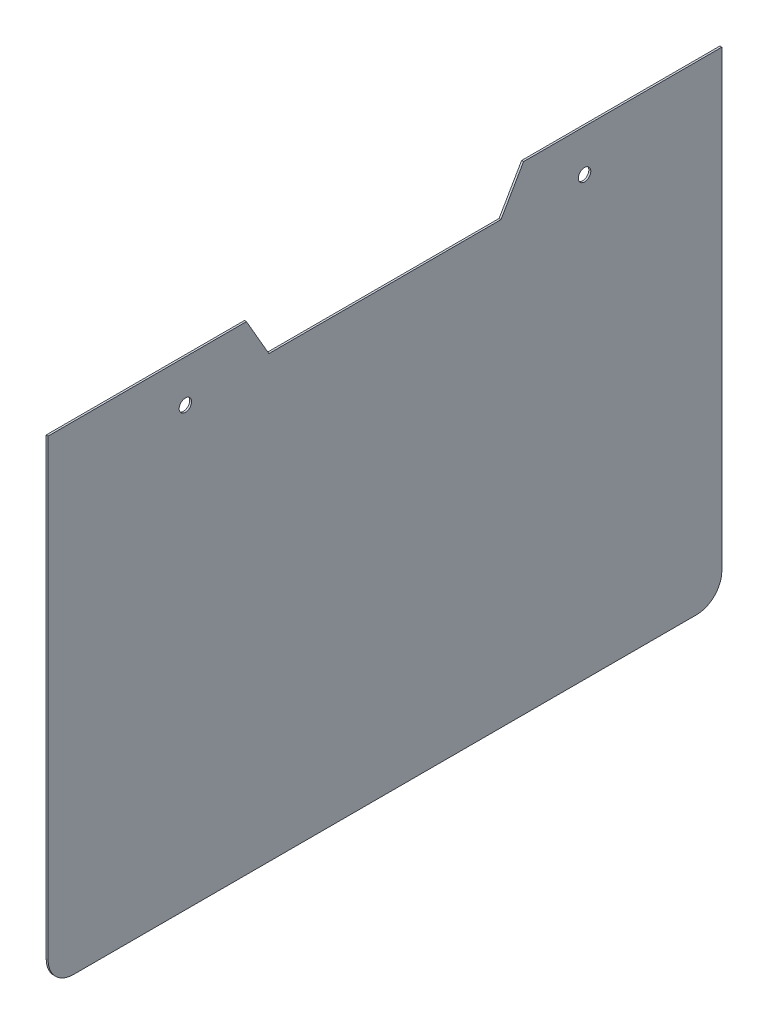
from build123d import *

# Parameters (mm, degrees)
BOSS_EXTRUDE1_DEPTH = 0.5
CUT_EXTRUDE2_REACH  = 381.906
SKETCH2_R           = 1.6
CUT_EXTRUDE3_DEPTH  = 0.25


with BuildPart() as part:
    # Sketch1 → Boss-Extrude1 (new body)
    with BuildSketch(Plane.ZY.offset(-169.533617861)):
        with BuildLine():
            Line((-82.985361374, 164.213254624), (-82.985361374, 280.713254624))
            Line((-82.985361374, 280.713254624), (-133.908011105, 280.713254624))
            Line((-133.908011105, 280.713254624), (-139.681513797, 270.713254624))
            Line((-139.681513797, 270.713254624), (-199.289208951, 270.713254624))
            Line((-199.289208951, 270.713254624), (-205.062711643, 280.713254624))
            Line((-205.062711643, 280.713254624), (-255.985361374, 280.713254624))
            Line((-255.985361374, 280.713254624), (-255.985361374, 164.213254624))
            ThreePointArc((-255.985361374, 164.213254624), (-254.081555452, 159.617060547), (-249.485361374, 157.713254624))
            Line((-249.485361374, 157.713254624), (-89.485361374, 157.713254624))
            ThreePointArc((-89.485361374, 157.713254624), (-84.889167296, 159.617060547), (-82.985361374, 164.213254624))
        make_face()
    extrude(amount=BOSS_EXTRUDE1_DEPTH)

    # Sketch2 → Cut-Extrude2 (cut, up to next)
    with BuildSketch(Plane.ZY.offset(-169.033617861), mode=Mode.PRIVATE) as cut_extrude2_sk1:
        with Locations((-118.235361374, 269.963254624)):
            Circle(SKETCH2_R)
    cut_extrude2_tool1 = extrude(cut_extrude2_sk1.sketch, amount=-CUT_EXTRUDE2_REACH, mode=Mode.PRIVATE) & part.part
    # Sketch2 → Cut-Extrude2 (cut, up to next)
    with BuildSketch(Plane.ZY.offset(-169.033617861), mode=Mode.PRIVATE) as cut_extrude2_sk2:
        with Locations((-220.735361374, 269.963254624)):
            Circle(SKETCH2_R)
    cut_extrude2_tool2 = extrude(cut_extrude2_sk2.sketch, amount=-CUT_EXTRUDE2_REACH, mode=Mode.PRIVATE) & part.part
    add(cut_extrude2_tool1.solids().sort_by_distance((169.033618, 269.963255, -118.235361))[0], mode=Mode.SUBTRACT)
    add(cut_extrude2_tool2.solids().sort_by_distance((169.033618, 269.963255, -220.735361))[0], mode=Mode.SUBTRACT)

    # Sketch4 → Cut-Extrude3 (cut)
    # profile 1 of 11: a face of its own
    with BuildSketch(Plane(origin=(169.033617861, 0, -163.257078024), x_dir=(0, 0, 1), z_dir=(-1, 0, 0))):
        with BuildLine():
            Line((1.31445665, 240.491320834), (-13.92554335, 240.489200834))
            Line((-13.92554335, 240.489200834), (-13.92554335, 240.452160834))
            add(Edge.make_bspline(
                [(-13.92554335, 240.452160834), (-13.92554335, 232.182360834), (-13.92554335, 226.720280834), (-6.32246335, 222.719800834)],
                knots=[0.125, 0.125, 0.125, 0.125, 0.25, 0.25, 0.25, 0.25], degree=3))
            Line((-6.32246335, 222.719800834), (-6.30554335, 222.710280834))
            Line((-6.30554335, 222.710280834), (-6.28862335, 222.719800834))
            add(Edge.make_bspline(
                [(-6.28862335, 222.719800834), (1.31445665, 226.703360834), (1.31445665, 232.173880834), (1.31445665, 240.454280834)],
                knots=[0.5, 0.5, 0.5, 0.5, 0.625, 0.625, 0.625, 0.625], degree=3))
            Line((1.31445665, 240.454280834), (1.31445665, 240.491320834))
        make_face()
        with BuildLine():
            Line((0.74505665, 239.879600834), (0.74505665, 239.854200834))
            add(Edge.make_bspline(
                [(0.74505665, 239.263640834), (0.74505665, 239.460520834), (0.74505665, 239.657360834), (0.74505665, 239.854200834)],
                knots=[0.833333333, 0.833333333, 0.833333333, 0.833333333, 1, 1, 1, 1], degree=3))
            add(Edge.make_bspline(
                [(-6.28862335, 223.399240834), (0.75881665, 227.060000834), (0.75245665, 232.988800834), (0.74505665, 239.263640834)],
                knots=[0.75, 0.75, 0.75, 0.75, 0.833333333, 0.833333333, 0.833333333, 0.833333333], degree=3))
            Line((-6.28862335, 223.399240834), (-6.30026335, 223.392880834))
            Line((-6.30026335, 223.392880834), (-6.31190335, 223.399240834))
            add(Edge.make_bspline(
                [(-10.40446335, 226.537200834), (-9.35354335, 225.302120834), (-8.01474335, 224.275560834), (-6.31190335, 223.399240834)],
                knots=[0.5, 0.5, 0.5, 0.5, 0.583333333, 0.583333333, 0.583333333, 0.583333333], degree=3))
            add(Edge.make_bspline(
                [(-12.50418335, 230.349320834), (-12.03006335, 228.886720834), (-11.34318335, 227.640000834), (-10.40446335, 226.537200834)],
                knots=[0.416666667, 0.416666667, 0.416666667, 0.416666667, 0.5, 0.5, 0.5, 0.5], degree=3))
            add(Edge.make_bspline(
                [(-13.37626335, 239.173680834), (-13.38154335, 236.033640834), (-13.38578335, 233.068160834), (-12.50418335, 230.349320834)],
                knots=[0.333333333, 0.333333333, 0.333333333, 0.333333333, 0.416666667, 0.416666667, 0.416666667, 0.416666667], degree=3))
            add(Edge.make_bspline(
                [(-13.37522335, 239.852080834), (-13.37522335, 239.625600834), (-13.37522335, 239.399120834), (-13.37626335, 239.173680834)],
                knots=[0.25, 0.25, 0.25, 0.25, 0.333333333, 0.333333333, 0.333333333, 0.333333333], degree=3))
            Line((-13.37522335, 239.852080834), (-13.37522335, 239.877480834))
            Line((-13.37522335, 239.877480834), (0.74505665, 239.879600834))
        make_face(mode=Mode.SUBTRACT)
    # profile 2 of 11: a face of its own
    with BuildSketch(Plane(origin=(169.033617861, 0, -163.257078024), x_dir=(0, 0, 1), z_dir=(-1, 0, 0))):
        Polygon((-6.23674335, 236.958600834), (-4.07882335, 236.287640834), (-4.07882335, 237.371360834), (-8.35342335, 237.371360834), (-8.35342335, 236.298200834), align=None)
    # profile 3 of 11: a face of its own
    with BuildSketch(Plane(origin=(169.033617861, 0, -163.257078024), x_dir=(0, 0, 1), z_dir=(-1, 0, 0))):
        with BuildLine():
            add(Edge.make_bspline(
                [(-6.23778335, 239.069960834), (-6.48650335, 238.842440834), (-6.76378335, 238.577880834), (-6.76378335, 238.201080834)],
                knots=[0.5, 0.5, 0.5, 0.5, 1, 1, 1, 1], degree=3))
            Line((-6.76378335, 238.201080834), (-5.69698335, 238.201080834))
            add(Edge.make_bspline(
                [(-5.69698335, 238.201080834), (-5.69170335, 238.567280834), (-5.98590335, 238.846680834), (-6.23778335, 239.069960834)],
                knots=[0.25, 0.25, 0.25, 0.25, 0.5, 0.5, 0.5, 0.5], degree=3))
        make_face()
    # profile 4 of 11: a face of its own
    with BuildSketch(Plane(origin=(169.033617861, 0, -163.257078024), x_dir=(0, 0, 1), z_dir=(-1, 0, 0))):
        with BuildLine():
            add(Edge.make_bspline(
                [(-4.59422335, 237.409480834), (-4.79318335, 237.771400834), (-5.20806335, 238.050800834), (-5.71818335, 238.164040834)],
                knots=[0.6, 0.6, 0.6, 0.6, 1, 1, 1, 1], degree=3))
            Line((-5.71818335, 238.164040834), (-6.72886335, 238.164040834))
            add(Edge.make_bspline(
                [(-6.72886335, 238.164040834), (-7.23898335, 238.049720834), (-7.65386335, 237.771400834), (-7.85282335, 237.409440834)],
                knots=[0.2, 0.2, 0.2, 0.2, 0.4, 0.4, 0.4, 0.4], degree=3))
            Line((-7.85282335, 237.409440834), (-4.59422335, 237.409480834))
        make_face()
    # profile 5 of 11: a face of its own
    with BuildSketch(Plane(origin=(169.033617861, 0, -163.257078024), x_dir=(0, 0, 1), z_dir=(-1, 0, 0))):
        with BuildLine():
            add(Edge.make_bspline(
                [(-8.80954335, 229.737600834), (-8.76510335, 229.757720834), (-8.76722335, 229.693160834), (-8.76722335, 229.633880834)],
                knots=[0, 0, 0, 0, 0.058823529, 0.058823529, 0.058823529, 0.058823529], degree=3))
            Line((-8.76722335, 229.633880834), (-8.76722335, 228.388240834))
            add(Edge.make_bspline(
                [(-8.76722335, 228.388240834), (-8.76722335, 228.293000834), (-8.83706335, 228.261240834), (-8.92702335, 228.255960834)],
                knots=[0.117647059, 0.117647059, 0.117647059, 0.117647059, 0.176470588, 0.176470588, 0.176470588, 0.176470588], degree=3))
            Line((-8.92702335, 228.255960834), (-9.13022335, 228.247480834))
            Line((-9.13022335, 228.247480834), (-9.13022335, 228.142720834))
            add(Edge.make_bspline(
                [(-9.13022335, 228.142720834), (-8.80106335, 228.145880834), (-8.67938335, 228.151200834), (-8.43486335, 228.151200834), (-8.31634335, 228.145920834), (-8.06022335, 228.142720834)],
                knots=[0.294117647, 0.294117647, 0.294117647, 0.294117647, 0.352941176, 0.352941176, 0.413304997, 0.413304997, 0.413304997, 0.413304997], degree=3))
            Line((-8.06022335, 228.142720834), (-8.06022335, 228.247480834))
            Line((-8.06022335, 228.247480834), (-8.23590335, 228.255960834))
            add(Edge.make_bspline(
                [(-8.23590335, 228.255960834), (-8.32482335, 228.261240834), (-8.39570335, 228.291960834), (-8.39570335, 228.388240834)],
                knots=[0.529411765, 0.529411765, 0.529411765, 0.529411765, 0.588235294, 0.588235294, 0.588235294, 0.588235294], degree=3))
            Line((-8.39570335, 228.388240834), (-8.39570335, 229.294160834))
            add(Edge.make_bspline(
                [(-8.39570335, 229.294160834), (-8.39570335, 229.630720834), (-8.37666335, 229.872000834), (-8.36714335, 230.007480834)],
                knots=[0.647058824, 0.647058824, 0.647058824, 0.647058824, 0.705882353, 0.705882353, 0.705882353, 0.705882353], degree=3))
            Line((-8.36714335, 230.007480834), (-8.40206335, 230.037120834))
            add(Edge.make_bspline(
                [(-8.40206335, 230.037120834), (-8.64442335, 229.940800834), (-9.03706335, 229.801120834), (-9.24238335, 229.752440834)],
                knots=[0.764705882, 0.764705882, 0.764705882, 0.764705882, 0.823529412, 0.823529412, 0.823529412, 0.823529412], degree=3))
            add(Edge.make_bspline(
                [(-9.24238335, 229.752440834), (-9.24662335, 229.693160834), (-9.23390335, 229.630720834), (-9.20322335, 229.555600834)],
                knots=[0.823529412, 0.823529412, 0.823529412, 0.823529412, 0.882352941, 0.882352941, 0.882352941, 0.882352941], degree=3))
            Line((-9.20322335, 229.555600834), (-8.80954335, 229.737600834))
        make_face()
    # profile 6 of 11: a face of its own
    with BuildSketch(Plane(origin=(169.033617861, 0, -163.257078024), x_dir=(0, 0, 1), z_dir=(-1, 0, 0))):
        with BuildLine():
            add(Edge.make_bspline(
                [(-5.63350335, 229.737600834), (-5.58906335, 229.757720834), (-5.59118335, 229.693160834), (-5.59118335, 229.633880834)],
                knots=[0, 0, 0, 0, 0.058823529, 0.058823529, 0.058823529, 0.058823529], degree=3))
            Line((-5.59118335, 229.633880834), (-5.59118335, 228.388240834))
            add(Edge.make_bspline(
                [(-5.59118335, 228.388240834), (-5.59118335, 228.293000834), (-5.66102335, 228.261240834), (-5.75098335, 228.255960834)],
                knots=[0.117647059, 0.117647059, 0.117647059, 0.117647059, 0.176470588, 0.176470588, 0.176470588, 0.176470588], degree=3))
            Line((-5.75098335, 228.255960834), (-5.95418335, 228.247480834))
            Line((-5.95418335, 228.247480834), (-5.95418335, 228.142720834))
            add(Edge.make_bspline(
                [(-5.95418335, 228.142720834), (-5.62502335, 228.145880834), (-5.50334335, 228.151200834), (-5.25882335, 228.151200834), (-5.14030335, 228.145920834), (-4.88314335, 228.142720834)],
                knots=[0.294117647, 0.294117647, 0.294117647, 0.294117647, 0.352941176, 0.352941176, 0.413304997, 0.413304997, 0.413304997, 0.413304997], degree=3))
            Line((-4.88314335, 228.142720834), (-4.88314335, 228.247480834))
            Line((-4.88314335, 228.247480834), (-5.05882335, 228.255960834))
            add(Edge.make_bspline(
                [(-5.05882335, 228.255960834), (-5.14878335, 228.261240834), (-5.21862335, 228.291960834), (-5.21862335, 228.388240834)],
                knots=[0.529411765, 0.529411765, 0.529411765, 0.529411765, 0.588235294, 0.588235294, 0.588235294, 0.588235294], degree=3))
            Line((-5.21862335, 228.388240834), (-5.21862335, 229.294160834))
            add(Edge.make_bspline(
                [(-5.21862335, 229.294160834), (-5.21862335, 229.630720834), (-5.19958335, 229.872000834), (-5.19110335, 230.007480834)],
                knots=[0.647058824, 0.647058824, 0.647058824, 0.647058824, 0.705882353, 0.705882353, 0.705882353, 0.705882353], degree=3))
            Line((-5.19110335, 230.007480834), (-5.22498335, 230.037120834))
            add(Edge.make_bspline(
                [(-5.22498335, 230.037120834), (-5.46630335, 229.940800834), (-5.85998335, 229.801120834), (-6.06634335, 229.752440834)],
                knots=[0.764705882, 0.764705882, 0.764705882, 0.764705882, 0.823529412, 0.823529412, 0.823529412, 0.823529412], degree=3))
            add(Edge.make_bspline(
                [(-6.06634335, 229.752440834), (-6.06846335, 229.693160834), (-6.05786335, 229.630720834), (-6.02614335, 229.555600834)],
                knots=[0.823529412, 0.823529412, 0.823529412, 0.823529412, 0.882352941, 0.882352941, 0.882352941, 0.882352941], degree=3))
            Line((-6.02614335, 229.555600834), (-5.63350335, 229.737600834))
        make_face()
    # profile 7 of 11: a face of its own
    with BuildSketch(Plane(origin=(169.033617861, 0, -163.257078024), x_dir=(0, 0, 1), z_dir=(-1, 0, 0))):
        with BuildLine():
            add(Edge.make_bspline(
                [(-4.14970335, 229.737600834), (-4.10526335, 229.757720834), (-4.10738335, 229.693160834), (-4.10738335, 229.633880834)],
                knots=[0, 0, 0, 0, 0.058823529, 0.058823529, 0.058823529, 0.058823529], degree=3))
            Line((-4.10738335, 229.633880834), (-4.10738335, 228.388240834))
            add(Edge.make_bspline(
                [(-4.10738335, 228.388240834), (-4.10738335, 228.293000834), (-4.17722335, 228.261240834), (-4.26718335, 228.255960834)],
                knots=[0.117647059, 0.117647059, 0.117647059, 0.117647059, 0.176470588, 0.176470588, 0.176470588, 0.176470588], degree=3))
            Line((-4.26718335, 228.255960834), (-4.46934335, 228.247480834))
            Line((-4.46934335, 228.247480834), (-4.46934335, 228.142720834))
            add(Edge.make_bspline(
                [(-4.46934335, 228.142720834), (-4.14018335, 228.145880834), (-4.01850335, 228.151200834), (-3.77506335, 228.151200834), (-3.65654335, 228.145920834), (-3.39938335, 228.142720834)],
                knots=[0.294117647, 0.294117647, 0.294117647, 0.294117647, 0.352941176, 0.352941176, 0.413850089, 0.413850089, 0.413850089, 0.413850089], degree=3))
            Line((-3.39938335, 228.142720834), (-3.39938335, 228.247480834))
            Line((-3.39938335, 228.247480834), (-3.57506335, 228.255960834))
            add(Edge.make_bspline(
                [(-3.57506335, 228.255960834), (-3.66502335, 228.261240834), (-3.73594335, 228.291960834), (-3.73594335, 228.388240834)],
                knots=[0.529411765, 0.529411765, 0.529411765, 0.529411765, 0.588235294, 0.588235294, 0.588235294, 0.588235294], degree=3))
            Line((-3.73594335, 228.388240834), (-3.73594335, 229.294160834))
            add(Edge.make_bspline(
                [(-3.73594335, 229.294160834), (-3.73594335, 229.630720834), (-3.71690335, 229.872000834), (-3.70738335, 230.007480834)],
                knots=[0.647058824, 0.647058824, 0.647058824, 0.647058824, 0.705882353, 0.705882353, 0.705882353, 0.705882353], degree=3))
            Line((-3.70738335, 230.007480834), (-3.74126335, 230.037120834))
            add(Edge.make_bspline(
                [(-3.74126335, 230.037120834), (-3.98258335, 229.940800834), (-4.37626335, 229.801120834), (-4.58262335, 229.752440834)],
                knots=[0.764705882, 0.764705882, 0.764705882, 0.764705882, 0.823529412, 0.823529412, 0.823529412, 0.823529412], degree=3))
            add(Edge.make_bspline(
                [(-4.58262335, 229.752440834), (-4.58578335, 229.693160834), (-4.57414335, 229.630720834), (-4.54242335, 229.555600834)],
                knots=[0.823529412, 0.823529412, 0.823529412, 0.823529412, 0.882352941, 0.882352941, 0.882352941, 0.882352941], degree=3))
            Line((-4.54242335, 229.555600834), (-4.14970335, 229.737600834))
        make_face()
    # profile 8 of 11: a face of its own
    with BuildSketch(Plane(origin=(169.033617861, 0, -163.257078024), x_dir=(0, 0, 1), z_dir=(-1, 0, 0))):
        with BuildLine():
            add(Edge.make_bspline(
                [(-5.45462335, 232.808840834), (-5.53506335, 232.810960834), (-5.61654335, 232.813080834), (-5.69698335, 232.815200834)],
                knots=[0.09375, 0.09375, 0.09375, 0.09375, 0.125, 0.125, 0.125, 0.125], degree=3))
            Line((-5.69698335, 232.815200834), (-5.71922335, 232.815200834))
            Line((-5.71922335, 232.815200834), (-5.71922335, 232.596120834))
            Line((-5.71922335, 232.596120834), (-5.47158335, 232.586600834))
            add(Edge.make_bspline(
                [(-5.47158335, 232.586600834), (-5.32554335, 232.581320834), (-5.24722335, 232.556960834), (-5.24722335, 232.447960834)],
                knots=[0.21875, 0.21875, 0.21875, 0.21875, 0.25, 0.25, 0.25, 0.25], degree=3))
            Line((-5.24722335, 232.447960834), (-5.24722335, 231.895520834))
            add(Edge.make_bspline(
                [(-5.24722335, 231.895520834), (-5.43242335, 231.826720834), (-5.59966335, 231.793920834), (-6.61034335, 231.793920834), (-6.90774335, 232.533680834), (-6.90774335, 233.887320834), (-6.49710335, 234.333920834), (-5.44938335, 234.333920834), (-5.10434335, 234.222800834), (-4.95194335, 234.049240834)],
                knots=[0.28125, 0.28125, 0.28125, 0.28125, 0.3125, 0.3125, 0.464365434, 0.464365434, 0.636765136, 0.636765136, 0.737446312, 0.737446312, 0.737446312, 0.737446312], degree=3))
            Line((-4.95194335, 234.049240834), (-4.93078335, 233.687280834))
            Line((-4.93078335, 233.687280834), (-4.92970335, 233.668240834))
            Line((-4.92970335, 233.668240834), (-4.72334335, 233.668240834))
            Line((-4.72334335, 233.668240834), (-4.71382335, 233.753960834))
            add(Edge.make_bspline(
                [(-4.71382335, 233.753960834), (-4.69158335, 233.944480834), (-4.65986335, 234.205880834), (-4.62282335, 234.342400834)],
                knots=[0.53125, 0.53125, 0.53125, 0.53125, 0.5625, 0.5625, 0.5625, 0.5625], degree=3))
            Line((-4.62282335, 234.342400834), (-4.61966335, 234.350880834))
            Line((-4.61966335, 234.350880834), (-4.65354335, 234.411200834))
            Line((-4.65354335, 234.411200834), (-4.65990335, 234.414360834))
            add(Edge.make_bspline(
                [(-4.65990335, 234.414360834), (-5.09698335, 234.594280834), (-5.50762335, 234.618600834), (-6.71942335, 234.618600834), (-7.59570335, 234.152920834), (-7.59570335, 232.125160834), (-6.93426335, 231.511360834), (-5.46738335, 231.511360834), (-5.05358335, 231.596040834), (-4.60482335, 231.769600834)],
                knots=[0.65625, 0.65625, 0.65625, 0.65625, 0.6875, 0.6875, 0.766346377, 0.766346377, 0.841184953, 0.841184953, 0.869452555, 0.869452555, 0.869452555, 0.869452555], degree=3))
            Line((-4.60482335, 231.769600834), (-4.59106335, 231.774880834))
            Line((-4.59106335, 231.774880834), (-4.59106335, 232.492440834))
            add(Edge.make_bspline(
                [(-4.59106335, 232.492440834), (-4.59106335, 232.580280834), (-4.53922335, 232.595080834), (-4.38786335, 232.625800834)],
                knots=[0.84375, 0.84375, 0.84375, 0.84375, 0.875, 0.875, 0.875, 0.875], degree=3))
            Line((-4.38786335, 232.625800834), (-4.37094335, 232.628960834))
            Line((-4.37094335, 232.628960834), (-4.37094335, 232.815240834))
            Line((-4.37094335, 232.815240834), (-4.39206335, 232.814160834))
            add(Edge.make_bspline(
                [(-4.39206335, 232.814160834), (-4.45238335, 232.813120834), (-4.51590335, 232.811000834), (-4.58150335, 232.809920834)],
                knots=[0, 0, 0, 0, 0.03125, 0.03125, 0.03125, 0.03125], degree=3))
            add(Edge.make_bspline(
                [(-4.58150335, 232.809920834), (-4.74450335, 232.805680834), (-4.91486335, 232.801440834), (-5.19426335, 232.801440834), (-5.32654335, 232.804600834), (-5.45462335, 232.808840834)],
                knots=[0.03125, 0.03125, 0.03125, 0.03125, 0.0625, 0.0625, 0.08934988, 0.08934988, 0.08934988, 0.08934988], degree=3))
        make_face()
    # profile 9 of 11: a face of its own
    with BuildSketch(Plane(origin=(169.033617861, 0, -163.257078024), x_dir=(0, 0, 1), z_dir=(-1, 0, 0))):
        with BuildLine():
            add(Edge.make_bspline(
                [(-8.11106335, 234.282080834), (-8.09518335, 234.313840834), (-8.06342335, 234.333920834), (-7.95126335, 234.343480834)],
                knots=[0, 0, 0, 0, 0.015151515, 0.015151515, 0.015151515, 0.015151515], degree=3))
            Line((-7.95126335, 234.343480834), (-7.77242335, 234.358280834))
            Line((-7.77242335, 234.358280834), (-7.77242335, 234.559360834))
            Line((-7.77242335, 234.559360834), (-7.79466335, 234.559360834))
            add(Edge.make_bspline(
                [(-7.79466335, 234.559360834), (-7.88462335, 234.557240834), (-7.96398335, 234.555120834), (-8.03598335, 234.551960834)],
                knots=[0.060606061, 0.060606061, 0.060606061, 0.060606061, 0.075757576, 0.075757576, 0.075757576, 0.075757576], degree=3))
            add(Edge.make_bspline(
                [(-8.03598335, 234.551960834), (-8.13442335, 234.548800834), (-8.22014335, 234.545600834), (-8.29422335, 234.545600834)],
                knots=[0.075757576, 0.075757576, 0.075757576, 0.075757576, 0.090909091, 0.090909091, 0.090909091, 0.090909091], degree=3))
            add(Edge.make_bspline(
                [(-8.29422335, 234.545600834), (-8.36726335, 234.545600834), (-8.45402335, 234.548760834), (-8.55350335, 234.551960834)],
                knots=[0.090909091, 0.090909091, 0.090909091, 0.090909091, 0.106060606, 0.106060606, 0.106060606, 0.106060606], degree=3))
            add(Edge.make_bspline(
                [(-8.55350335, 234.551960834), (-8.62442335, 234.554080834), (-8.70166335, 234.557240834), (-8.78846335, 234.558320834)],
                knots=[0.106060606, 0.106060606, 0.106060606, 0.106060606, 0.121212121, 0.121212121, 0.121212121, 0.121212121], degree=3))
            Line((-8.78846335, 234.558320834), (-8.80326335, 234.558320834))
            Line((-8.80326335, 234.558320834), (-8.80854335, 234.544560834))
            add(Edge.make_bspline(
                [(-8.80854335, 234.544560834), (-8.82758335, 234.501160834), (-8.84666335, 234.455640834), (-8.86570335, 234.408040834)],
                knots=[0.151515152, 0.151515152, 0.151515152, 0.151515152, 0.166666667, 0.166666667, 0.166666667, 0.166666667], degree=3))
            add(Edge.make_bspline(
                [(-8.86570335, 234.408040834), (-8.91438335, 234.291640834), (-8.96414335, 234.170960834), (-9.01914335, 234.058800834)],
                knots=[0.166666667, 0.166666667, 0.166666667, 0.166666667, 0.181818182, 0.181818182, 0.181818182, 0.181818182], degree=3))
            Line((-9.01914335, 234.058800834), (-9.78854335, 232.471280834))
            Line((-9.78854335, 232.471280834), (-10.44894335, 233.851360834))
            add(Edge.make_bspline(
                [(-10.44894335, 233.851360834), (-10.47962335, 233.916960834), (-10.51666335, 233.996360834), (-10.55690335, 234.079960834)],
                knots=[0.212121212, 0.212121212, 0.212121212, 0.212121212, 0.227272727, 0.227272727, 0.227272727, 0.227272727], degree=3))
            add(Edge.make_bspline(
                [(-10.55690335, 234.079960834), (-10.63414335, 234.242960834), (-10.72094335, 234.428160834), (-10.77282335, 234.544560834)],
                knots=[0.227272727, 0.227272727, 0.227272727, 0.227272727, 0.242424242, 0.242424242, 0.242424242, 0.242424242], degree=3))
            Line((-10.77282335, 234.544560834), (-10.77918335, 234.558320834))
            Line((-10.77918335, 234.558320834), (-10.79294335, 234.558320834))
            add(Edge.make_bspline(
                [(-10.79294335, 234.558320834), (-10.84058335, 234.557280834), (-10.88818335, 234.555160834), (-10.93686335, 234.554080834)],
                knots=[0.272727273, 0.272727273, 0.272727273, 0.272727273, 0.287878788, 0.287878788, 0.287878788, 0.287878788], degree=3))
            add(Edge.make_bspline(
                [(-10.93686335, 234.554080834), (-11.17922335, 234.545600834), (-11.43534335, 234.544560834), (-11.68086335, 234.554080834)],
                knots=[0.287878788, 0.287878788, 0.287878788, 0.287878788, 0.303030303, 0.303030303, 0.303030303, 0.303030303], degree=3))
            add(Edge.make_bspline(
                [(-11.68086335, 234.554080834), (-11.72954335, 234.555120834), (-11.77718335, 234.557240834), (-11.82586335, 234.558320834)],
                knots=[0.303030303, 0.303030303, 0.303030303, 0.303030303, 0.318181818, 0.318181818, 0.318181818, 0.318181818], degree=3))
            Line((-11.82586335, 234.558320834), (-11.84810335, 234.558320834))
            Line((-11.84810335, 234.558320834), (-11.84810335, 234.357240834))
            Line((-11.84810335, 234.357240834), (-11.66926335, 234.342440834))
            add(Edge.make_bspline(
                [(-11.66926335, 234.342440834), (-11.55814335, 234.333960834), (-11.52638335, 234.312800834), (-11.50946335, 234.282120834)],
                knots=[0.363636364, 0.363636364, 0.363636364, 0.363636364, 0.378787879, 0.378787879, 0.378787879, 0.378787879], degree=3))
            add(Edge.make_bspline(
                [(-11.50946335, 234.282120834), (-11.48722335, 234.233440834), (-11.48194335, 234.121240834), (-11.48194335, 233.942400834)],
                knots=[0.378787879, 0.378787879, 0.378787879, 0.378787879, 0.393939394, 0.393939394, 0.393939394, 0.393939394], degree=3))
            Line((-11.48194335, 233.942400834), (-11.48194335, 232.185560834))
            add(Edge.make_bspline(
                [(-11.48194335, 232.185560834), (-11.48194335, 232.010920834), (-11.48618335, 231.893440834), (-11.50946335, 231.847960834)],
                knots=[0.409090909, 0.409090909, 0.409090909, 0.409090909, 0.424242424, 0.424242424, 0.424242424, 0.424242424], degree=3))
            add(Edge.make_bspline(
                [(-11.50946335, 231.847960834), (-11.52638335, 231.815160834), (-11.55814335, 231.794000834), (-11.66926335, 231.785520834)],
                knots=[0.424242424, 0.424242424, 0.424242424, 0.424242424, 0.439393939, 0.439393939, 0.439393939, 0.439393939], degree=3))
            Line((-11.66926335, 231.785520834), (-11.84810335, 231.770720834))
            Line((-11.84810335, 231.770720834), (-11.84810335, 231.569640834))
            Line((-11.84810335, 231.569640834), (-11.82586335, 231.569640834))
            add(Edge.make_bspline(
                [(-11.82586335, 231.569640834), (-11.77402335, 231.570680834), (-11.72110335, 231.572800834), (-11.66818335, 231.574920834)],
                knots=[0.484848485, 0.484848485, 0.484848485, 0.484848485, 0.5, 0.5, 0.5, 0.5], degree=3))
            add(Edge.make_bspline(
                [(-11.66818335, 231.574920834), (-11.55706335, 231.579160834), (-11.44274335, 231.583400834), (-11.22050335, 231.583400834), (-11.10830335, 231.579160834), (-10.99930335, 231.574920834)],
                knots=[0.5, 0.5, 0.5, 0.5, 0.515151515, 0.515151515, 0.53030303, 0.53030303, 0.53030303, 0.53030303], degree=3))
            add(Edge.make_bspline(
                [(-10.99930335, 231.574920834), (-10.94638335, 231.572800834), (-10.89346335, 231.570680834), (-10.84054335, 231.569640834)],
                knots=[0.53030303, 0.53030303, 0.53030303, 0.53030303, 0.545454545, 0.545454545, 0.545454545, 0.545454545], degree=3))
            Line((-10.84054335, 231.569640834), (-10.81830335, 231.569640834))
            Line((-10.81830335, 231.569640834), (-10.81830335, 231.770720834))
            Line((-10.81830335, 231.770720834), (-10.99822335, 231.785520834))
            add(Edge.make_bspline(
                [(-10.99822335, 231.785520834), (-11.10830335, 231.794000834), (-11.14110335, 231.815160834), (-11.15802335, 231.846920834)],
                knots=[0.590909091, 0.590909091, 0.590909091, 0.590909091, 0.606060606, 0.606060606, 0.606060606, 0.606060606], degree=3))
            add(Edge.make_bspline(
                [(-11.15802335, 231.846920834), (-11.18130335, 231.893480834), (-11.18554335, 232.010960834), (-11.18554335, 232.185600834)],
                knots=[0.606060606, 0.606060606, 0.606060606, 0.606060606, 0.621212121, 0.621212121, 0.621212121, 0.621212121], degree=3))
            Line((-11.18554335, 232.185600834), (-11.18550335, 233.888400834))
            Line((-11.18550335, 233.888400834), (-10.23618335, 231.910360834))
            Line((-10.23618335, 231.910360834), (-10.21926335, 231.874360834))
            add(Edge.make_bspline(
                [(-10.21926335, 231.874360834), (-10.16846335, 231.765360834), (-10.12082335, 231.662680834), (-10.08274335, 231.554760834)],
                knots=[0.666666667, 0.666666667, 0.666666667, 0.666666667, 0.681818182, 0.681818182, 0.681818182, 0.681818182], degree=3))
            Line((-10.08274335, 231.554760834), (-10.07746335, 231.541000834))
            Line((-10.07746335, 231.541000834), (-9.90070335, 231.541000834))
            Line((-9.90070335, 231.541000834), (-9.89542335, 231.554760834))
            add(Edge.make_bspline(
                [(-9.89542335, 231.554760834), (-9.83826335, 231.698680834), (-9.75362335, 231.884960834), (-9.63826335, 232.123080834)],
                knots=[0.727272727, 0.727272727, 0.727272727, 0.727272727, 0.742424242, 0.742424242, 0.742424242, 0.742424242], degree=3))
            Line((-9.63826335, 232.123080834), (-8.79158335, 233.885200834))
            Line((-8.79158335, 233.885200834), (-8.79158335, 232.187640834))
            add(Edge.make_bspline(
                [(-8.79158335, 232.187640834), (-8.79158335, 232.013000834), (-8.79582335, 231.895520834), (-8.81910335, 231.850040834)],
                knots=[0.772727273, 0.772727273, 0.772727273, 0.772727273, 0.787878788, 0.787878788, 0.787878788, 0.787878788], degree=3))
            add(Edge.make_bspline(
                [(-8.81910335, 231.850040834), (-8.83286335, 231.822520834), (-8.87942335, 231.807720834), (-8.97786335, 231.801360834)],
                knots=[0.787878788, 0.787878788, 0.787878788, 0.787878788, 0.803030303, 0.803030303, 0.803030303, 0.803030303], degree=3))
            Line((-8.97786335, 231.801360834), (-9.15670335, 231.786560834))
            Line((-9.15670335, 231.786560834), (-9.15670335, 231.572760834))
            Line((-9.15670335, 231.572760834), (-9.01910335, 231.575920834))
            add(Edge.make_bspline(
                [(-9.01910335, 231.575920834), (-8.86246335, 231.580160834), (-8.66878335, 231.585440834), (-8.46346335, 231.585440834)],
                knots=[0.848484848, 0.848484848, 0.848484848, 0.848484848, 0.863636364, 0.863636364, 0.863636364, 0.863636364], degree=3))
            add(Edge.make_bspline(
                [(-8.46346335, 231.585440834), (-8.26342335, 231.585440834), (-8.06974335, 231.580160834), (-7.91418335, 231.575920834)],
                knots=[0.863636364, 0.863636364, 0.863636364, 0.863636364, 0.878787879, 0.878787879, 0.878787879, 0.878787879], degree=3))
            Line((-7.91418335, 231.575920834), (-7.77342335, 231.572760834))
            Line((-7.77342335, 231.572760834), (-7.77342335, 231.786560834))
            Line((-7.77342335, 231.786560834), (-7.95334335, 231.801360834))
            add(Edge.make_bspline(
                [(-7.95334335, 231.801360834), (-8.05178335, 231.808760834), (-8.09834335, 231.823600834), (-8.11314335, 231.850040834)],
                knots=[0.924242424, 0.924242424, 0.924242424, 0.924242424, 0.939393939, 0.939393939, 0.939393939, 0.939393939], degree=3))
            add(Edge.make_bspline(
                [(-8.11314335, 231.850040834), (-8.13642335, 231.896600834), (-8.14066335, 232.014080834), (-8.14066335, 232.188720834)],
                knots=[0.939393939, 0.939393939, 0.939393939, 0.939393939, 0.954545455, 0.954545455, 0.954545455, 0.954545455], degree=3))
            Line((-8.14066335, 232.188720834), (-8.14066335, 233.945560834))
            add(Edge.make_bspline(
                [(-8.14066335, 233.945560834), (-8.13858335, 234.121240834), (-8.13434335, 234.234480834), (-8.11106335, 234.282080834)],
                knots=[0.96969697, 0.96969697, 0.96969697, 0.96969697, 1, 1, 1, 1], degree=3))
        make_face()
    # profile 10 of 11: a face of its own
    with BuildSketch(Plane(origin=(169.033617861, 0, -163.257078024), x_dir=(0, 0, 1), z_dir=(-1, 0, 0))):
        with BuildLine():
            add(Edge.make_bspline(
                [(-1.11546335, 234.282080834), (-1.10170335, 234.308520834), (-1.05406335, 234.323360834), (-0.95566335, 234.330760834)],
                knots=[0, 0, 0, 0, 0.015384615, 0.015384615, 0.015384615, 0.015384615], degree=3))
            Line((-0.95566335, 234.330760834), (-0.77470335, 234.345560834))
            Line((-0.77470335, 234.345560834), (-0.77470335, 234.558280834))
            Line((-0.77470335, 234.558280834), (-0.79694335, 234.558280834))
            add(Edge.make_bspline(
                [(-0.79694335, 234.558280834), (-0.84562335, 234.557240834), (-0.89854335, 234.556160834), (-0.95570335, 234.555120834)],
                knots=[0.061538462, 0.061538462, 0.061538462, 0.061538462, 0.076923077, 0.076923077, 0.076923077, 0.076923077], degree=3))
            add(Edge.make_bspline(
                [(-0.95570335, 234.555120834), (-1.10914335, 234.550880834), (-1.28486335, 234.546640834), (-1.66054335, 234.546640834), (-1.83518335, 234.550880834), (-1.99074335, 234.555120834)],
                knots=[0.076923077, 0.076923077, 0.076923077, 0.076923077, 0.092307692, 0.092307692, 0.107956648, 0.107956648, 0.107956648, 0.107956648], degree=3))
            add(Edge.make_bspline(
                [(-1.99074335, 234.555120834), (-2.04790335, 234.556160834), (-2.10082335, 234.558280834), (-2.14842335, 234.558280834)],
                knots=[0.107692308, 0.107692308, 0.107692308, 0.107692308, 0.123076923, 0.123076923, 0.123076923, 0.123076923], degree=3))
            Line((-2.14842335, 234.558280834), (-2.17066335, 234.558280834))
            Line((-2.17066335, 234.558280834), (-2.17066335, 234.345560834))
            Line((-2.17066335, 234.345560834), (-1.99074335, 234.330760834))
            add(Edge.make_bspline(
                [(-1.99074335, 234.330760834), (-1.89126335, 234.323360834), (-1.84362335, 234.308520834), (-1.82986335, 234.282080834)],
                knots=[0.169230769, 0.169230769, 0.169230769, 0.169230769, 0.184615385, 0.184615385, 0.184615385, 0.184615385], degree=3))
            add(Edge.make_bspline(
                [(-1.82986335, 234.282080834), (-1.80446335, 234.231280834), (-1.80234335, 234.092640834), (-1.80234335, 233.942360834)],
                knots=[0.184615385, 0.184615385, 0.184615385, 0.184615385, 0.2, 0.2, 0.2, 0.2], degree=3))
            Line((-1.80234335, 233.942360834), (-1.80234335, 233.281960834))
            add(Edge.make_bspline(
                [(-1.80234335, 233.281960834), (-1.86478335, 233.278800834), (-1.94946335, 233.274560834), (-2.13254335, 233.274560834)],
                knots=[0.215384615, 0.215384615, 0.215384615, 0.215384615, 0.230769231, 0.230769231, 0.230769231, 0.230769231], degree=3))
            Line((-2.13254335, 233.274560834), (-2.76858335, 233.274560834))
            add(Edge.make_bspline(
                [(-2.76858335, 233.274560834), (-2.95166335, 233.274560834), (-3.03634335, 233.278800834), (-3.09878335, 233.281960834)],
                knots=[0.246153846, 0.246153846, 0.246153846, 0.246153846, 0.261538462, 0.261538462, 0.261538462, 0.261538462], degree=3))
            Line((-3.09878335, 233.281960834), (-3.09878335, 233.942360834))
            add(Edge.make_bspline(
                [(-3.09878335, 233.942360834), (-3.09878335, 234.099000834), (-3.09666335, 234.232360834), (-3.07126335, 234.282080834)],
                knots=[0.276923077, 0.276923077, 0.276923077, 0.276923077, 0.292307692, 0.292307692, 0.292307692, 0.292307692], degree=3))
            add(Edge.make_bspline(
                [(-3.07126335, 234.282080834), (-3.05750335, 234.308520834), (-3.00986335, 234.323360834), (-2.90934335, 234.330760834)],
                knots=[0.292307692, 0.292307692, 0.292307692, 0.292307692, 0.307692308, 0.307692308, 0.307692308, 0.307692308], degree=3))
            Line((-2.90934335, 234.330760834), (-2.72942335, 234.345560834))
            Line((-2.72942335, 234.345560834), (-2.72942335, 234.558280834))
            Line((-2.72942335, 234.558280834), (-2.75166335, 234.558280834))
            add(Edge.make_bspline(
                [(-2.75166335, 234.558280834), (-2.80034335, 234.557240834), (-2.85430335, 234.556160834), (-2.91146335, 234.555120834)],
                knots=[0.353846154, 0.353846154, 0.353846154, 0.353846154, 0.369230769, 0.369230769, 0.369230769, 0.369230769], degree=3))
            add(Edge.make_bspline(
                [(-2.91146335, 234.555120834), (-3.06490335, 234.550880834), (-3.23954335, 234.546640834), (-3.61314335, 234.546640834), (-3.78990335, 234.550880834), (-3.94442335, 234.555120834)],
                knots=[0.369230769, 0.369230769, 0.369230769, 0.369230769, 0.384615385, 0.384615385, 0.400441088, 0.400441088, 0.400441088, 0.400441088], degree=3))
            add(Edge.make_bspline(
                [(-3.94442335, 234.555120834), (-4.00050335, 234.556160834), (-4.05342335, 234.558280834), (-4.10210335, 234.558280834)],
                knots=[0.4, 0.4, 0.4, 0.4, 0.415384615, 0.415384615, 0.415384615, 0.415384615], degree=3))
            Line((-4.10210335, 234.558280834), (-4.12434335, 234.558280834))
            Line((-4.12434335, 234.558280834), (-4.12434335, 234.345560834))
            Line((-4.12434335, 234.345560834), (-3.94338335, 234.330760834))
            add(Edge.make_bspline(
                [(-3.94338335, 234.330760834), (-3.84494335, 234.323360834), (-3.79626335, 234.308520834), (-3.78358335, 234.282080834)],
                knots=[0.461538462, 0.461538462, 0.461538462, 0.461538462, 0.476923077, 0.476923077, 0.476923077, 0.476923077], degree=3))
            add(Edge.make_bspline(
                [(-3.78358335, 234.282080834), (-3.75818335, 234.233400834), (-3.75606335, 234.099000834), (-3.75606335, 233.943400834)],
                knots=[0.476923077, 0.476923077, 0.476923077, 0.476923077, 0.492307692, 0.492307692, 0.492307692, 0.492307692], degree=3))
            Line((-3.75606335, 233.943400834), (-3.75606335, 232.186560834))
            add(Edge.make_bspline(
                [(-3.75606335, 232.186560834), (-3.75606335, 232.029920834), (-3.75818335, 231.897640834), (-3.79734335, 231.819320834), (-3.84286335, 231.805560834), (-3.94446335, 231.797080834)],
                knots=[0.507692308, 0.507692308, 0.507692308, 0.507692308, 0.523076923, 0.523076923, 0.531411266, 0.531411266, 0.531411266, 0.531411266], degree=3))
            Line((-3.94446335, 231.797080834), (-4.12542335, 231.783320834))
            Line((-4.12542335, 231.783320834), (-4.12542335, 231.568480834))
            Line((-4.12542335, 231.568480834), (-4.02806335, 231.571640834))
            add(Edge.make_bspline(
                [(-4.02806335, 231.571640834), (-3.85978335, 231.575880834), (-3.65130335, 231.582240834), (-3.42586335, 231.582240834)],
                knots=[0.584615385, 0.584615385, 0.584615385, 0.584615385, 0.6, 0.6, 0.6, 0.6], degree=3))
            add(Edge.make_bspline(
                [(-3.42586335, 231.582240834), (-3.20678335, 231.582240834), (-2.99830335, 231.575880834), (-2.83106335, 231.571640834)],
                knots=[0.6, 0.6, 0.6, 0.6, 0.615384615, 0.615384615, 0.615384615, 0.615384615], degree=3))
            Line((-2.83106335, 231.571640834), (-2.73050335, 231.568480834))
            Line((-2.73050335, 231.568480834), (-2.73050335, 231.783320834))
            Line((-2.73050335, 231.783320834), (-2.91042335, 231.797080834))
            add(Edge.make_bspline(
                [(-2.91042335, 231.797080834), (-3.01202335, 231.805560834), (-3.05858335, 231.819320834), (-3.07234335, 231.846840834)],
                knots=[0.661538462, 0.661538462, 0.661538462, 0.661538462, 0.676923077, 0.676923077, 0.676923077, 0.676923077], degree=3))
            add(Edge.make_bspline(
                [(-3.07234335, 231.846840834), (-3.09774335, 231.896600834), (-3.09986335, 232.029920834), (-3.09986335, 232.186560834)],
                knots=[0.676923077, 0.676923077, 0.676923077, 0.676923077, 0.692307692, 0.692307692, 0.692307692, 0.692307692], degree=3))
            Line((-3.09986335, 232.186560834), (-3.09986335, 232.984560834))
            add(Edge.make_bspline(
                [(-3.09986335, 232.984560834), (-3.03742335, 232.988800834), (-2.95274335, 232.991960834), (-2.76966335, 232.991960834)],
                knots=[0.707692308, 0.707692308, 0.707692308, 0.707692308, 0.723076923, 0.723076923, 0.723076923, 0.723076923], degree=3))
            Line((-2.76966335, 232.991960834), (-2.13358335, 232.991960834))
            add(Edge.make_bspline(
                [(-2.13358335, 232.991960834), (-1.95050335, 232.991960834), (-1.86582335, 232.988800834), (-1.80338335, 232.984560834)],
                knots=[0.738461538, 0.738461538, 0.738461538, 0.738461538, 0.753846154, 0.753846154, 0.753846154, 0.753846154], degree=3))
            Line((-1.80338335, 232.984560834), (-1.80338335, 232.186560834))
            add(Edge.make_bspline(
                [(-1.80338335, 232.186560834), (-1.80338335, 232.036280834), (-1.80550335, 231.898680834), (-1.83090335, 231.846840834)],
                knots=[0.769230769, 0.769230769, 0.769230769, 0.769230769, 0.784615385, 0.784615385, 0.784615385, 0.784615385], degree=3))
            add(Edge.make_bspline(
                [(-1.83090335, 231.846840834), (-1.84466335, 231.819320834), (-1.89122335, 231.805560834), (-1.99282335, 231.797080834)],
                knots=[0.784615385, 0.784615385, 0.784615385, 0.784615385, 0.8, 0.8, 0.8, 0.8], degree=3))
            Line((-1.99282335, 231.797080834), (-2.17274335, 231.783320834))
            Line((-2.17274335, 231.783320834), (-2.17274335, 231.568480834))
            Line((-2.17274335, 231.568480834), (-2.07430335, 231.571640834))
            add(Edge.make_bspline(
                [(-2.07430335, 231.571640834), (-1.90710335, 231.576920834), (-1.69754335, 231.582240834), (-1.25198335, 231.582240834), (-1.04350335, 231.575880834), (-0.87626335, 231.571640834)],
                knots=[0.846153846, 0.846153846, 0.846153846, 0.846153846, 0.861538462, 0.861538462, 0.876706392, 0.876706392, 0.876706392, 0.876706392], degree=3))
            Line((-0.87626335, 231.571640834), (-0.77678335, 231.568480834))
            Line((-0.77678335, 231.568480834), (-0.77678335, 231.783320834))
            Line((-0.77678335, 231.783320834), (-0.95774335, 231.797080834))
            add(Edge.make_bspline(
                [(-0.95774335, 231.797080834), (-1.05830335, 231.805560834), (-1.10486335, 231.819320834), (-1.11754335, 231.846840834)],
                knots=[0.923076923, 0.923076923, 0.923076923, 0.923076923, 0.938461538, 0.938461538, 0.938461538, 0.938461538], degree=3))
            add(Edge.make_bspline(
                [(-1.11754335, 231.846840834), (-1.14398335, 231.896600834), (-1.14610335, 232.029920834), (-1.14610335, 232.185520834)],
                knots=[0.938461538, 0.938461538, 0.938461538, 0.938461538, 0.953846154, 0.953846154, 0.953846154, 0.953846154], degree=3))
            Line((-1.14610335, 232.185520834), (-1.14610335, 233.942360834))
            add(Edge.make_bspline(
                [(-1.14610335, 233.942360834), (-1.14406335, 234.099000834), (-1.14194335, 234.232360834), (-1.11546335, 234.282080834)],
                knots=[0.969230769, 0.969230769, 0.969230769, 0.969230769, 1, 1, 1, 1], degree=3))
        make_face()
    # profile 11 of 11: a face of its own
    with BuildSketch(Plane(origin=(169.033617861, 0, -163.257078024), x_dir=(0, 0, 1), z_dir=(-1, 0, 0))):
        with BuildLine():
            add(Edge.make_bspline(
                [(-6.52358335, 229.594760834), (-6.52354335, 229.881520834), (-6.75322335, 230.007480834), (-7.39562335, 230.007480834), (-7.60942335, 229.794760834), (-7.60942335, 229.282520834), (-7.50358335, 229.143880834), (-7.32898335, 229.051840834)],
                knots=[0.777777778, 0.777777778, 0.777777778, 0.777777778, 1, 1, 1.326078421, 1.326078421, 1.538668765, 1.538668765, 1.538668765, 1.538668765], degree=3))
            add(Edge.make_bspline(
                [(-7.32898335, 229.051840834), (-7.50890335, 228.972480834), (-7.65814335, 228.801000834), (-7.65814335, 228.354360834), (-7.48670335, 228.103560834), (-6.73210335, 228.103560834), (-6.43894335, 228.356520834), (-6.43894335, 229.011600834), (-6.63686335, 229.154480834), (-6.78818335, 229.209520834)],
                knots=[0.222222222, 0.222222222, 0.222222222, 0.222222222, 0.333333333, 0.333333333, 0.463926229, 0.463926229, 0.582967032, 0.582967032, 0.675670688, 0.675670688, 0.675670688, 0.675670688], degree=3))
            add(Edge.make_bspline(
                [(-6.78818335, 229.209520834), (-6.63050335, 229.310080834), (-6.52358335, 229.434960834), (-6.52358335, 229.594760834)],
                knots=[0.666666667, 0.666666667, 0.666666667, 0.666666667, 0.777777778, 0.777777778, 0.777777778, 0.777777778], degree=3))
        make_face()
        with BuildLine():
            add(Edge.make_bspline(
                [(-7.04110335, 228.924800834), (-6.88130335, 228.853880834), (-6.74794335, 228.766040834), (-6.74794335, 228.397760834), (-6.87178335, 228.248520834), (-7.26018335, 228.248520834), (-7.40622335, 228.417840834), (-7.40622335, 228.795680834), (-7.33850335, 228.894080834), (-7.21254335, 229.001000834)],
                knots=[0, 0, 0, 0, 0.166666667, 0.166666667, 0.311826864, 0.311826864, 0.483765771, 0.483765771, 0.628237329, 0.628237329, 0.628237329, 0.628237329], degree=3))
            Line((-7.21254335, 229.001000834), (-7.04110335, 228.924800834))
        make_face(mode=Mode.SUBTRACT)
        with BuildLine():
            add(Edge.make_bspline(
                [(-7.04954335, 229.308960834), (-7.18182335, 229.366120834), (-7.31942335, 229.442320834), (-7.31942335, 229.771440834), (-7.20406335, 229.861400834), (-6.86646335, 229.861400834), (-6.75954335, 229.732280834), (-6.75954335, 229.442320834), (-6.81670335, 229.343880834), (-6.92570335, 229.257120834)],
                knots=[0, 0, 0, 0, 0.166666667, 0.166666667, 0.323962517, 0.323962517, 0.510331428, 0.510331428, 0.629754332, 0.629754332, 0.629754332, 0.629754332], degree=3))
            Line((-6.92570335, 229.257120834), (-7.04954335, 229.308960834))
        make_face(mode=Mode.SUBTRACT)
    extrude(amount=-CUT_EXTRUDE3_DEPTH, mode=Mode.SUBTRACT)


solid = part.part
